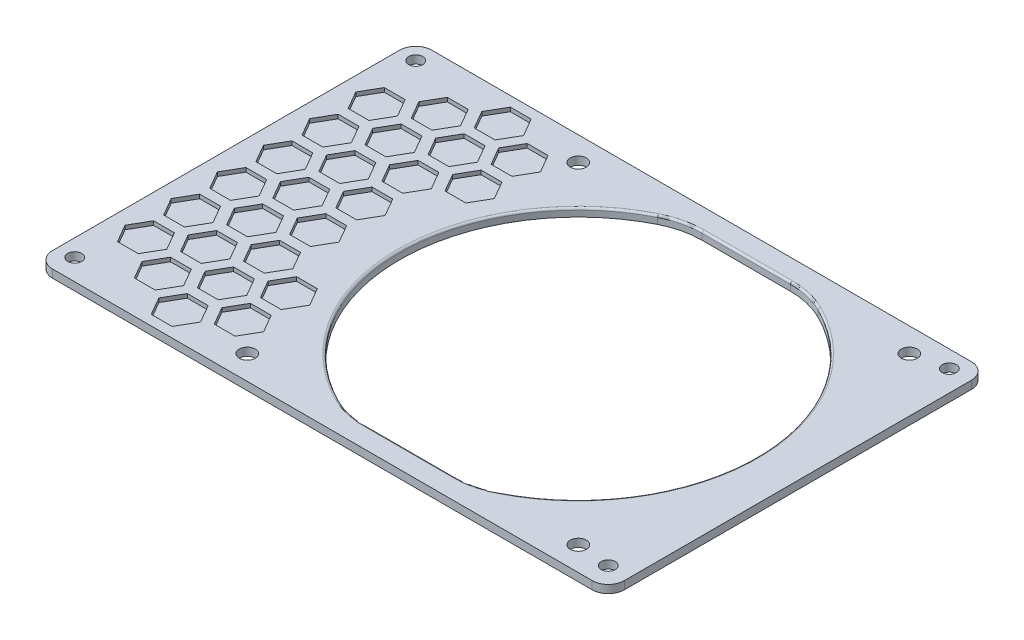
from build123d import *

# Parameters (mm, degrees)
SKETCH1_W           = 143
SKETCH1_H           = 95
SKETCH1_R           = 1.75
BOSS_EXTRUDE1_DEPTH = 2
SKETCH3_W           = 152.5
SKETCH3_H           = 104.5
SKETCH3_W_2         = 142.5
SKETCH3_H_2         = 94.5
CUT_EXTRUDE1_DEPTH  = 2
FILLET1_R           = 4
SKETCH4_R           = 2
CUT_EXTRUDE2_DEPTH  = 20
CUT_EXTRUDE3_DEPTH  = 1
FILL_START          = 1
FILL_PATTERN1_DEPTH = 1
FILLET2_R           = 20
FILLET3_R           = 0.5


# Read off the part's stored shape, not the designer's step: Fill Pattern1
with BuildPart() as part:
    # Sketch1 → Boss-Extrude1 (new body)
    with BuildSketch(Plane(origin=(0, 0, 0), x_dir=(1, 0, 0), z_dir=(0, 1, 0))):
        with Locations((2.188679245, -6.504716981)):
            Rectangle(SKETCH1_W, SKETCH1_H)
        with Locations(Location((-64.811320755, 36.495283019, 0), (0, 0, 270))):
            Circle(SKETCH1_R, mode=Mode.SUBTRACT)
        with Locations(Location((68.188679245, 36.495283019, 0), (0, 0, 270))):
            Circle(SKETCH1_R, mode=Mode.SUBTRACT)
        with Locations(Location((68.188679245, -48.504716981, 0), (0, 0, 270))):
            Circle(SKETCH1_R, mode=Mode.SUBTRACT)
        with Locations(Location((-64.811320755, -48.504716981, 0), (0, 0, 270))):
            Circle(SKETCH1_R, mode=Mode.SUBTRACT)
    extrude(amount=BOSS_EXTRUDE1_DEPTH)

    # Sketch3 → Cut-Extrude1 (cut)
    with BuildSketch(Plane(origin=(0, 2, 0), x_dir=(1, 0, 0), z_dir=(0, 1, 0))):
        with Locations((2.188679245, -6.504716981)):
            Rectangle(SKETCH3_W, SKETCH3_H)
        with Locations((2.188679245, -6.504716981)):
            Rectangle(SKETCH3_W_2, SKETCH3_H_2, mode=Mode.SUBTRACT)
    extrude(amount=-CUT_EXTRUDE1_DEPTH, mode=Mode.SUBTRACT)

    # Fillet1
    fillet1_edges = [part.edges().sort_by_distance(p)[0] for p in [
        (-69.061320755, 1, -40.745283019),
        (73.438679245, 1, -40.745283019),
        (73.438679245, 1, 53.754716981),
        (-69.061320755, 1, 53.754716981),
    ]]
    fillet(fillet1_edges, radius=FILLET1_R)

    # Sketch4 → Cut-Extrude2 (cut)
    with BuildSketch(Plane(origin=(0, 2, 0), x_dir=(1, 0, 0), z_dir=(0, 1, 0))):
        with Locations(Location((-22.538803992, 34.745283019, 0), (0, 0, 270))):
            Circle(SKETCH4_R)
        with Locations(Location((59.961196008, 34.745283019, 0), (0, 0, 270))):
            Circle(SKETCH4_R)
        with Locations(Location((-22.538803992, -47.754716981, 0), (0, 0, 270))):
            Circle(SKETCH4_R)
        with Locations(Location((59.961196008, -47.754716981, 0), (0, 0, 270))):
            Circle(SKETCH4_R)
        with BuildLine():
            Line((33.688679245, -48.400420818), (3.688679245, -48.400420818))
            ThreePointArc((3.688679245, -48.400420818), (-25.811320755, -6.504716981), (3.688679245, 35.390986856))
            Line((3.688679245, 35.390986856), (33.688679245, 35.390986856))
            ThreePointArc((33.688679245, 35.390986856), (63.188679245, -6.504716981), (33.688679245, -48.400420818))
        make_face()
    extrude(amount=-CUT_EXTRUDE2_DEPTH, mode=Mode.SUBTRACT)

    # Sketch6 → Cut-Extrude3 (cut)
    with BuildSketch(Plane(origin=(0, 2, 0), x_dir=(1, 0, 0), z_dir=(0, 1, 0))):
        Polygon((-55.536595335, -6.504716981), (-52.938519124, -11.004716981), (-47.742366701, -11.004716981), (-45.144290489, -6.504716981), (-47.742366701, -2.004716981), (-52.938519124, -2.004716981), align=None)
    extrude(amount=-CUT_EXTRUDE3_DEPTH, mode=Mode.SUBTRACT)

    # Fill Pattern1 outline → Fill Pattern1 (cut)
    with BuildSketch(Plane(origin=(0, 0, 0), x_dir=(1, 0, 0), z_dir=(0, 1, 0)).offset(FILL_START)):
        Polygon((-37.783074557, 15.245283019), (-42.97922698, 15.245283019), (-45.577303191, 10.745283019), (-42.97922698, 6.245283019), (-37.783074557, 6.245283019), (-35.184998346, 10.745283019), align=None)
        Polygon((-27.823782414, 32.495283019), (-33.019934837, 32.495283019), (-35.618011048, 27.995283019), (-33.019934837, 23.495283019), (-27.823782414, 23.495283019), (-25.225706202, 27.995283019), align=None)
        Polygon((-57.701658844, -19.254716981), (-62.897811267, -19.254716981), (-65.495887478, -23.754716981), (-62.897811267, -28.254716981), (-57.701658844, -28.254716981), (-55.103582633, -23.754716981), align=None)
        Polygon((-57.701658844, 6.245283019), (-55.103582633, 10.745283019), (-57.701658844, 15.245283019), (-62.897811267, 15.245283019), (-65.495887478, 10.745283019), (-62.897811267, 6.245283019), align=None)
        Polygon((-27.823782414, -45.504716981), (-25.225706202, -41.004716981), (-27.823782414, -36.504716981), (-33.019934837, -36.504716981), (-35.618011048, -41.004716981), (-33.019934837, -45.504716981), align=None)
        Polygon((-37.783074557, -28.254716981), (-35.184998346, -23.754716981), (-37.783074557, -19.254716981), (-42.97922698, -19.254716981), (-45.577303191, -23.754716981), (-42.97922698, -28.254716981), align=None)
        Polygon((-37.783074557, -42.254716981), (-42.97922698, -42.254716981), (-45.577303191, -46.754716981), (-42.97922698, -51.254716981), (-37.783074557, -51.254716981), (-35.184998346, -46.754716981), align=None)
        Polygon((-27.823782414, -25.004716981), (-33.019934837, -25.004716981), (-35.618011048, -29.504716981), (-33.019934837, -34.004716981), (-27.823782414, -34.004716981), (-25.225706202, -29.504716981), align=None)
        Polygon((-47.742366701, -34.004716981), (-45.144290489, -29.504716981), (-47.742366701, -25.004716981), (-52.938519124, -25.004716981), (-55.536595335, -29.504716981), (-52.938519124, -34.004716981), align=None)
        Polygon((-57.701658844, -16.754716981), (-55.103582633, -12.254716981), (-57.701658844, -7.754716981), (-62.897811267, -7.754716981), (-65.495887478, -12.254716981), (-62.897811267, -16.754716981), align=None)
        Polygon((-47.742366701, 32.495283019), (-52.938519124, 32.495283019), (-55.536595335, 27.995283019), (-52.938519124, 23.495283019), (-47.742366701, 23.495283019), (-45.144290489, 27.995283019), align=None)
        Polygon((-47.742366701, 20.995283019), (-52.938519124, 20.995283019), (-55.536595335, 16.495283019), (-52.938519124, 11.995283019), (-47.742366701, 11.995283019), (-45.144290489, 16.495283019), align=None)
        Polygon((-57.701658844, 3.745283019), (-62.897811267, 3.745283019), (-65.495887478, -0.754716981), (-62.897811267, -5.254716981), (-57.701658844, -5.254716981), (-55.103582633, -0.754716981), align=None)
        Polygon((-37.783074557, 38.245283019), (-42.97922698, 38.245283019), (-45.577303191, 33.745283019), (-42.97922698, 29.245283019), (-37.783074557, 29.245283019), (-35.184998346, 33.745283019), align=None)
        Polygon((-25.225706202, 16.495283019), (-27.823782414, 20.995283019), (-33.019934837, 20.995283019), (-35.618011048, 16.495283019), (-33.019934837, 11.995283019), (-27.823782414, 11.995283019), align=None)
        Polygon((-37.783074557, -5.254716981), (-35.184998346, -0.754716981), (-37.783074557, 3.745283019), (-42.97922698, 3.745283019), (-45.577303191, -0.754716981), (-42.97922698, -5.254716981), align=None)
        Polygon((-37.783074557, -39.754716981), (-35.184998346, -35.254716981), (-37.783074557, -30.754716981), (-42.97922698, -30.754716981), (-45.577303191, -35.254716981), (-42.97922698, -39.754716981), align=None)
        Polygon((-47.742366701, -22.504716981), (-45.144290489, -18.004716981), (-47.742366701, -13.504716981), (-52.938519124, -13.504716981), (-55.536595335, -18.004716981), (-52.938519124, -22.504716981), align=None)
        Polygon((-47.742366701, 9.495283019), (-52.938519124, 9.495283019), (-55.536595335, 4.995283019), (-52.938519124, 0.495283019), (-47.742366701, 0.495283019), (-45.144290489, 4.995283019), align=None)
        Polygon((-37.783074557, 26.745283019), (-42.97922698, 26.745283019), (-45.577303191, 22.245283019), (-42.97922698, 17.745283019), (-37.783074557, 17.745283019), (-35.184998346, 22.245283019), align=None)
        Polygon((-57.701658844, 17.745283019), (-55.103582633, 22.245283019), (-57.701658844, 26.745283019), (-62.897811267, 26.745283019), (-65.495887478, 22.245283019), (-62.897811267, 17.745283019), align=None)
        Polygon((-37.783074557, -16.754716981), (-35.184998346, -12.254716981), (-37.783074557, -7.754716981), (-42.97922698, -7.754716981), (-45.577303191, -12.254716981), (-42.97922698, -16.754716981), align=None)
        Polygon((-57.701658844, -30.754716981), (-62.897811267, -30.754716981), (-65.495887478, -35.254716981), (-62.897811267, -39.754716981), (-57.701658844, -39.754716981), (-55.103582633, -35.254716981), align=None)
        Polygon((-45.144290489, -41.004716981), (-47.742366701, -36.504716981), (-52.938519124, -36.504716981), (-55.536595335, -41.004716981), (-52.938519124, -45.504716981), (-47.742366701, -45.504716981), align=None)
    extrude(amount=FILL_PATTERN1_DEPTH, mode=Mode.SUBTRACT)

    # Fillet2
    fillet2_edges = [part.edges().sort_by_distance(p)[0] for p in [
        (3.688679245, 1, 48.400420818),
        (3.688679245, 1, -35.390986856),
        (33.688679245, 1, -35.390986856),
        (33.688679245, 1, 48.400420818),
    ]]
    fillet(fillet2_edges, radius=FILLET2_R)

    # Fillet3
    fillet3_edges = [part.edges().sort_by_distance(p)[0] for p in [
        (18.688679245, 2, 48.400420818),
        (-25.811320755, 2, 6.504716981),
        (63.188679245, 2, 6.504716981),
        (18.688679245, 2, -35.390986856),
        (3.085684131, 2, 47.861675646),
        (34.29167436, 2, 47.861675646),
        (34.29167436, 2, -34.852241684),
        (3.085684131, 2, -34.852241684),
    ]]
    fillet(fillet3_edges, radius=FILLET3_R)


solid = part.part
